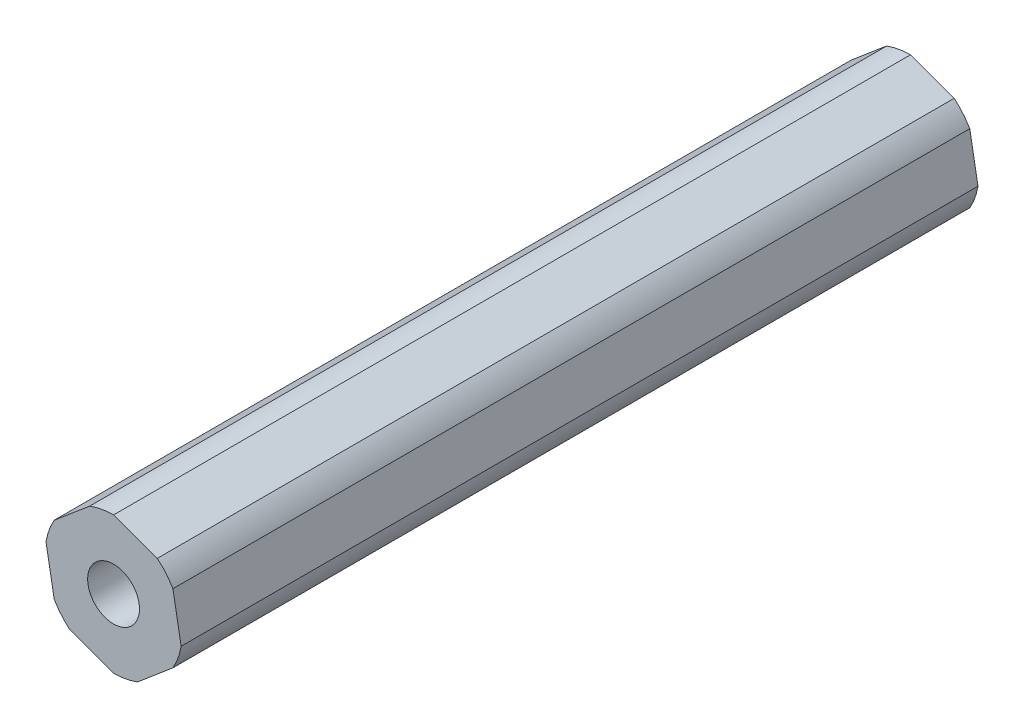
from build123d import *

# Parameters (mm, degrees)
BOSS_EXTRUDE1_DEPTH         = 78.486
SKETCH2_R                   = 2.0193
CUT_EXTRUDE1_DEPTH          = 80.056293928
F_1_4_20_TAPPED_HOLE1_D     = 5.1054
F_1_4_20_TAPPED_HOLE1_DEPTH = 19.05
F_1_4_20_TAPPED_HOLE1_TIP   = 1.533816902
F_1_4_20_TAPPED_HOLE2_D     = 5.1054
F_1_4_20_TAPPED_HOLE2_DEPTH = 19.05
F_1_4_20_TAPPED_HOLE2_TIP   = 1.533816902


with BuildPart() as part:
    # Sketch1 → Boss-Extrude1 (new body)
    with BuildSketch(Plane.XY):
        with BuildLine():
            Line((-6.654540832, 1.131188008), (-5.845671476, -3.375))
            ThreePointArc((-5.845671476, -3.375), (-5.15742276, -4.354709), (-4.306907968, -5.197407407))
            Line((-4.306907968, -5.197407407), (0, -6.75))
            ThreePointArc((0, -6.75), (1.19257724, -6.643813628), (2.347632865, -6.328595415))
            Line((2.347632865, -6.328595415), (5.845671476, -3.375))
            ThreePointArc((5.845671476, -3.375), (6.35, -2.289104628), (6.654540832, -1.131188008))
            Line((6.654540832, -1.131188008), (5.845671476, 3.375))
            ThreePointArc((5.845671476, 3.375), (5.15742276, 4.354709), (4.306907968, 5.197407407))
            Line((4.306907968, 5.197407407), (0, 6.75))
            ThreePointArc((0, 6.75), (-1.19257724, 6.643813628), (-2.347632865, 6.328595415))
            Line((-2.347632865, 6.328595415), (-5.845671476, 3.375))
            ThreePointArc((-5.845671476, 3.375), (-6.35, 2.289104628), (-6.654540832, 1.131188008))
        make_face()
    extrude(amount=BOSS_EXTRUDE1_DEPTH)

    # Sketch2 → Cut-Extrude1 (cut, through all)
    with BuildSketch(Plane.XY.offset(78.486)):
        Circle(SKETCH2_R)
    extrude(amount=-CUT_EXTRUDE1_DEPTH, mode=Mode.SUBTRACT)

    # 1/4-20 Tapped Hole1
    with Locations(Plane.XY.offset(78.486)):
        with Locations((0, 0)):
            Hole(F_1_4_20_TAPPED_HOLE1_D / 2, depth=F_1_4_20_TAPPED_HOLE1_DEPTH)
            with Locations((0, 0, -(F_1_4_20_TAPPED_HOLE1_DEPTH + F_1_4_20_TAPPED_HOLE1_TIP / 2))):  # 118° drill point
                Cone(0, F_1_4_20_TAPPED_HOLE1_D / 2, F_1_4_20_TAPPED_HOLE1_TIP, mode=Mode.SUBTRACT)

    # 1/4-20 Tapped Hole2
    with Locations(Plane(origin=(0, 0, 0), x_dir=(-1, 0, 0), z_dir=(0, 0, -1))):
        with Locations((0, 0)):
            Hole(F_1_4_20_TAPPED_HOLE2_D / 2, depth=F_1_4_20_TAPPED_HOLE2_DEPTH)
            with Locations((0, 0, -(F_1_4_20_TAPPED_HOLE2_DEPTH + F_1_4_20_TAPPED_HOLE2_TIP / 2))):  # 118° drill point
                Cone(0, F_1_4_20_TAPPED_HOLE2_D / 2, F_1_4_20_TAPPED_HOLE2_TIP, mode=Mode.SUBTRACT)


solid = part.part
